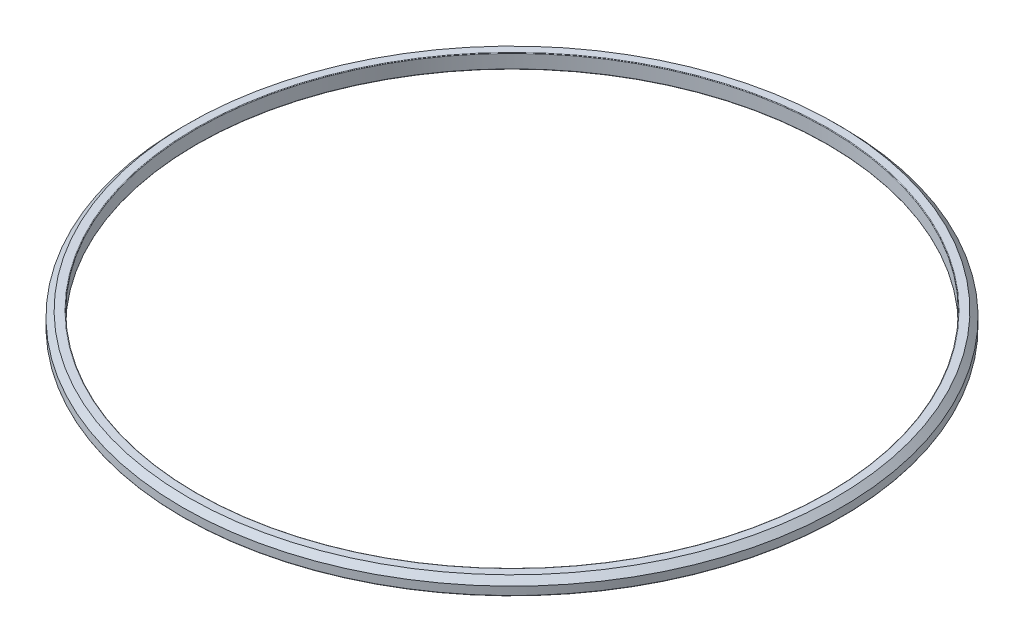
from build123d import *

# Parameters (mm, degrees)
SKETCH1_R           = 57.2125
SKETCH1_R_2         = 54.7875
BOSS_EXTRUDE1_DEPTH = 2.5
CHAMFER1_SIZE       = 1
FILLET1_R           = 0.1


with BuildPart() as part:
    # Sketch1 → Boss-Extrude1 (new body)
    with BuildSketch(Plane(origin=(0, 0, 0), x_dir=(1, 0, 0), z_dir=(0, 1, 0))):
        Circle(SKETCH1_R)
        Circle(SKETCH1_R_2, mode=Mode.SUBTRACT)
    extrude(amount=BOSS_EXTRUDE1_DEPTH)

    # Chamfer1
    chamfer1_edges = [part.edges().sort_by_distance(p)[0] for p in [
        (-57.2125, 2.5, 0),
    ]]
    chamfer(chamfer1_edges, length=CHAMFER1_SIZE)

    # Fillet1
    fillet1_edges = [part.edges().sort_by_distance(p)[0] for p in [
        (-54.7875, 2.5, 0),
        (-54.7875, 0, 0),
        (-57.2125, 0, 0),
    ]]
    fillet(fillet1_edges, radius=FILLET1_R)


solid = part.part
